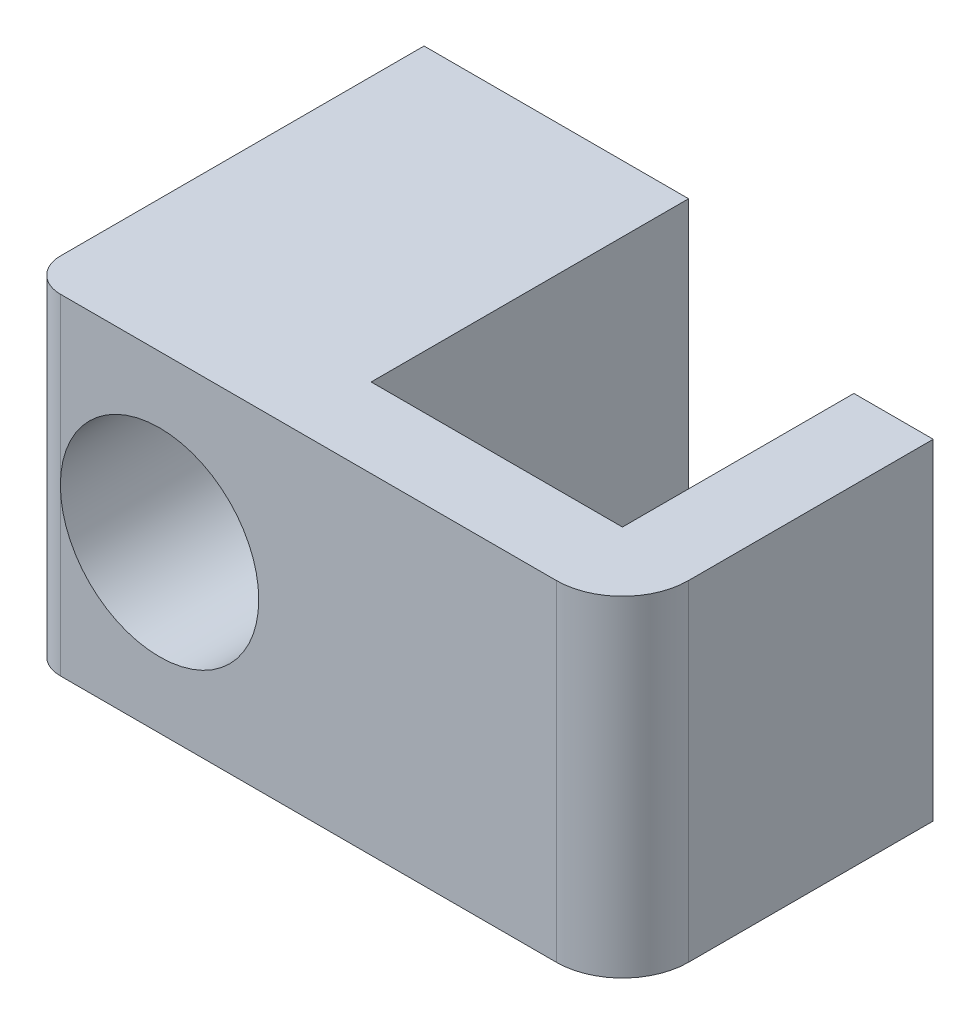
from build123d import *

# Parameters (mm, degrees)
SKETCH_1_W          = 4
SKETCH_1_H          = 5
EXTRUDE_1_DEPTH     = 6
SKETCH_4_W          = 1.2
SKETCH_4_H          = 5
EXTRUDE_2_DEPTH     = 5
SKETCH_5_W          = 1.2
SKETCH_5_H          = 5
EXTRUDE_3_DEPTH     = 3.5
FILLET_1_R          = 1
SKETCH_6_R          = 1.5
CUT_EXTRUDE_1_DEPTH = 10.552486587
FILLET_2_R          = 0.5


with BuildPart() as part:
    # 草图1 → 凸台-拉伸1 (new body)
    with BuildSketch(Plane.XY):
        Rectangle(SKETCH_1_W, SKETCH_1_H)
    extrude(amount=EXTRUDE_1_DEPTH)

    # 草图4 → 凸台-拉伸2 (add)
    with BuildSketch(Plane(origin=(2, 0, 0), x_dir=(0, 0, -1), z_dir=(1, 0, 0))):
        with Locations((-5.4, 0)):
            Rectangle(SKETCH_4_W, SKETCH_4_H)
    extrude(amount=EXTRUDE_2_DEPTH)

    # 草图5 → 凸台-拉伸3 (add)
    with BuildSketch(Plane(origin=(0, 0, 4.8), x_dir=(-1, 0, 0), z_dir=(0, 0, -1))):
        with Locations((-6.4, 0)):
            Rectangle(SKETCH_5_W, SKETCH_5_H)
    extrude(amount=EXTRUDE_3_DEPTH)

    # 圆角1
    fillet_1_edges = [part.edges().sort_by_distance(p)[0] for p in [
        (7, 0, 6),
    ]]
    fillet(fillet_1_edges, radius=FILLET_1_R)

    # 草图6 → 切除-拉伸1 (cut, through all)
    with BuildSketch(Plane.XY.offset(6)):
        Circle(SKETCH_6_R)
    extrude(amount=-CUT_EXTRUDE_1_DEPTH, mode=Mode.SUBTRACT)

    # 圆角2
    fillet_2_edges = [part.edges().sort_by_distance(p)[0] for p in [
        (-2, 0, 6),
    ]]
    fillet(fillet_2_edges, radius=FILLET_2_R - 0.0001)  # a hair under: the kernel refuses the full size


solid = part.part
